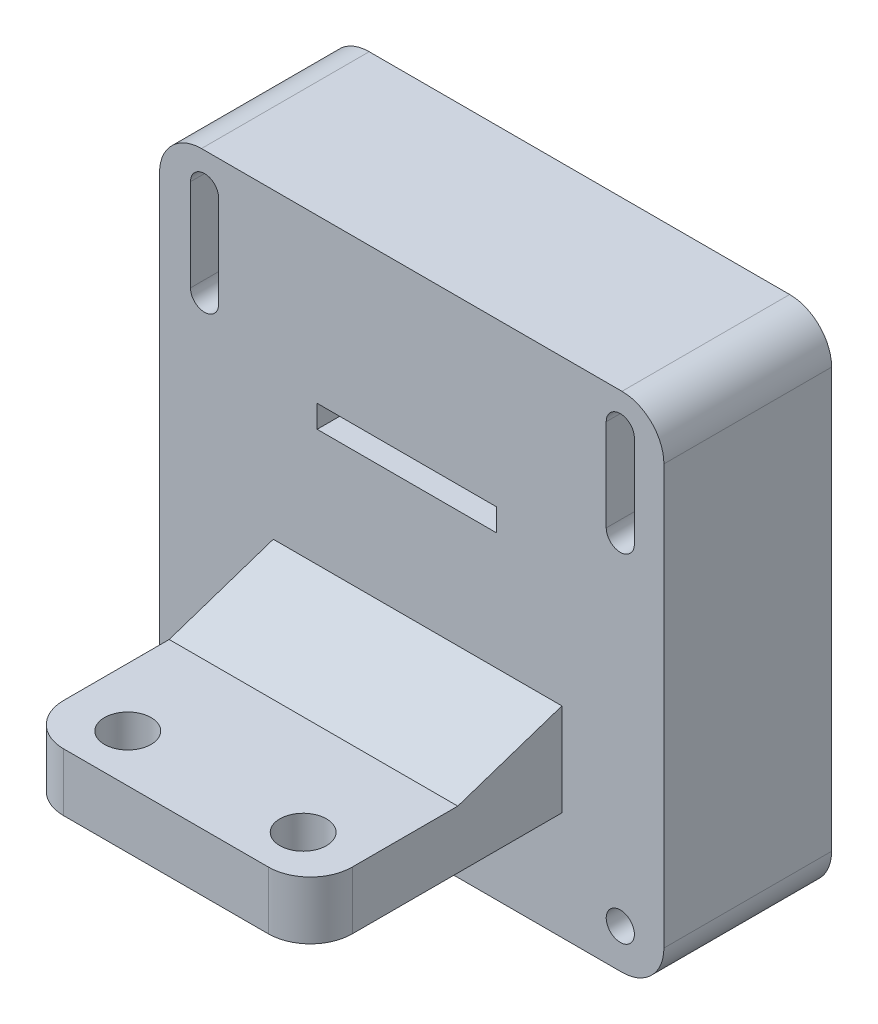
from build123d import *

# Parameters (mm, degrees)
CROQUIS1_W              = 60.14528302
CROQUIS1_H              = 60
CROQUIS1_R              = 1.678683546
CROQUIS1_W_2            = 21.375237152
CROQUIS1_H_2            = 2.685893673
SALIENTE_EXTRUIR1_DEPTH = 20
CROQUIS2_W              = 34.416081981
CROQUIS2_H              = 11.047137426
SALIENTE_EXTRUIR2_DEPTH = 30
CORTAR_EXTRUIR1_DEPTH   = 50
CROQUIS4_R              = 2.778810817
CORTAR_EXTRUIR2_DEPTH   = 52
REDONDEO1_R             = 5
REDONDEO2_R             = 5


with BuildPart() as part:
    # Croquis1 → Saliente-Extruir1 (new body)
    with BuildSketch(Plane.XY):
        with Locations((3.000280638, -1.75)):
            Rectangle(CROQUIS1_W, CROQUIS1_H)
        with Locations((27.873314814, -27.085103986)):
            Circle(CROQUIS1_R, mode=Mode.SUBTRACT)
        with Locations((-21.703805911, -27.085103986)):
            Circle(CROQUIS1_R, mode=Mode.SUBTRACT)
        with Locations((2.413281033, 7.495777062)):
            Rectangle(CROQUIS1_W_2, CROQUIS1_H_2, mode=Mode.SUBTRACT)
        with BuildLine():
            Line((-20.025122365, 24.170700285), (-20.025122365, 13.203301118))
            ThreePointArc((-20.025122365, 13.203301118), (-21.703805911, 11.524617572), (-23.382489457, 13.203301118))
            Line((-23.382489457, 13.203301118), (-23.382489457, 24.170700285))
            ThreePointArc((-23.382489457, 24.170700285), (-21.703805911, 25.849383831), (-20.025122365, 24.170700285))
        make_face(mode=Mode.SUBTRACT)
        with BuildLine():
            Line((29.55199836, 24.170700285), (29.55199836, 13.203301118))
            ThreePointArc((29.55199836, 13.203301118), (27.873314814, 11.524617572), (26.194631268, 13.203301118))
            Line((26.194631268, 13.203301118), (26.194631268, 24.170700285))
            ThreePointArc((26.194631268, 24.170700285), (27.873314814, 25.849383831), (29.55199836, 24.170700285))
        make_face(mode=Mode.SUBTRACT)
    extrude(amount=SALIENTE_EXTRUIR1_DEPTH)

    # Croquis2 → Saliente-Extruir2 (add)
    with BuildSketch(Plane.XY.offset(20)):
        with Locations((3.701330293, -13.343146768)):
            Rectangle(CROQUIS2_W, CROQUIS2_H)
    extrude(amount=SALIENTE_EXTRUIR2_DEPTH)

    # Croquis3 → Cortar-Extruir1 (cut)
    with BuildSketch(Plane(origin=(20.909371283, 0, 0), x_dir=(0, 0, -1), z_dir=(1, 0, 0))):
        Polygon((-32.414311293, -11.96225459), (-20, -7.819578055), (-32.414311293, -4.420458847), (-54.933476046, -4.420458847), (-54.933476046, -11.96225459), align=None)
    extrude(amount=-CORTAR_EXTRUIR1_DEPTH, mode=Mode.SUBTRACT)

    # Croquis4 → Cortar-Extruir2 (cut)
    with BuildSketch(Plane.XZ.offset(18.866715481)):
        with Locations((-6.523695114, 44.333086762)):
            Circle(CROQUIS4_R)
        with Locations((14.386898359, 44.333086762)):
            Circle(CROQUIS4_R)
    extrude(amount=-CORTAR_EXTRUIR2_DEPTH, mode=Mode.SUBTRACT)

    # Redondeo1
    redondeo1_edges = [part.edges().sort_by_distance(p)[0] for p in [
        (-13.506710698, -15.414485035, 50),
        (20.909371283, -15.414485035, 50),
    ]]
    fillet(redondeo1_edges, radius=REDONDEO1_R)

    # Redondeo2
    redondeo2_edges = [part.edges().sort_by_distance(p)[0] for p in [
        (-27.072360872, 28.25, 10),
        (33.072922148, 28.25, 10),
        (-27.072360872, -31.75, 10),
        (33.072922148, -31.75, 10),
    ]]
    fillet(redondeo2_edges, radius=REDONDEO2_R)


solid = part.part
